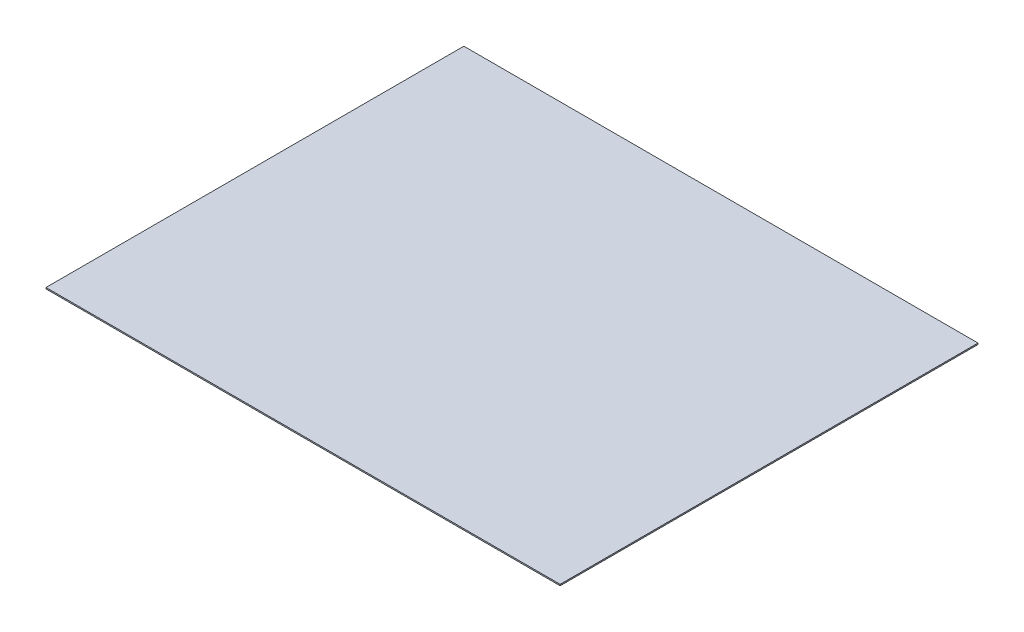
from build123d import *

# Parameters (mm, degrees)
SKETCH1_W           = 625.602
SKETCH1_H           = 508.4572
BOSS_EXTRUDE1_DEPTH = 1.5875


with BuildPart() as part:
    # Sketch1 → Boss-Extrude1 (new body)
    with BuildSketch(Plane(origin=(0, 0, 0), x_dir=(1, 0, 0), z_dir=(0, 1, 0))):
        with Locations((312.801, 254.2286)):
            Rectangle(SKETCH1_W, SKETCH1_H)
    extrude(amount=BOSS_EXTRUDE1_DEPTH)


solid = part.part
